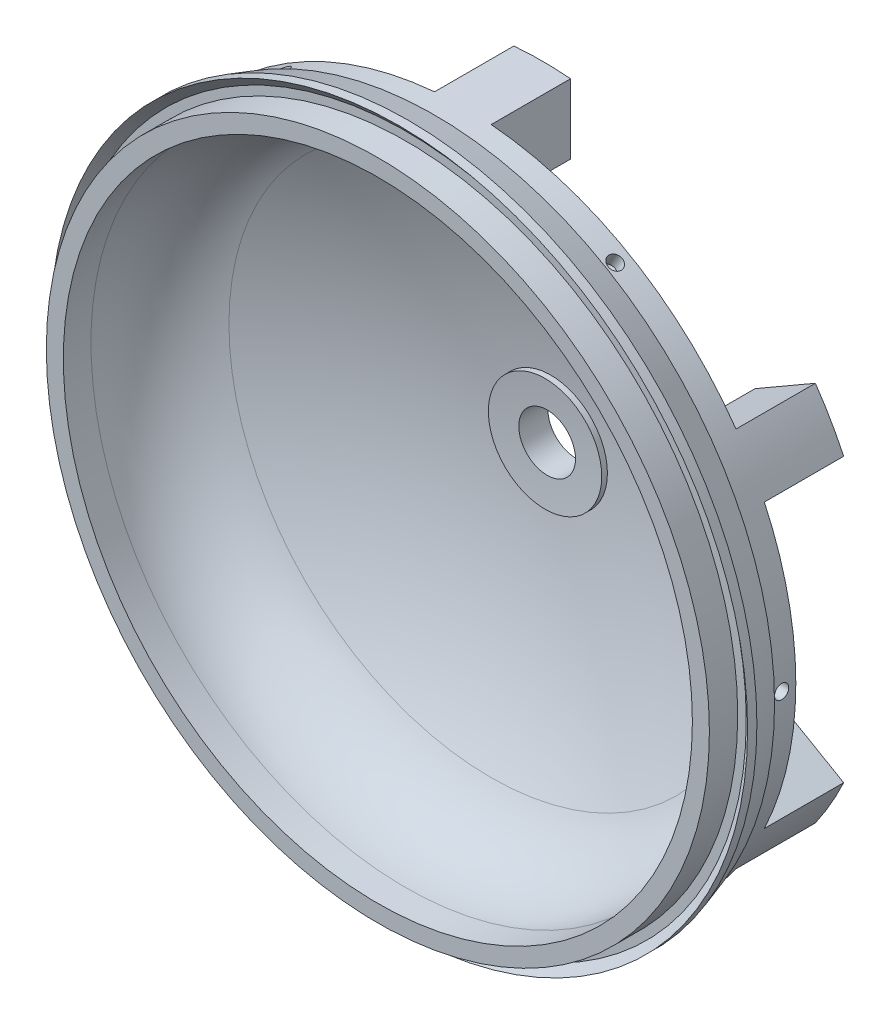
from build123d import *
from build123d.topology import SkipClean

# Parameters (mm, degrees)
CIRPATTERN1_COUNT   = 6
SKETCH17_R          = 12.7
CUT_EXTRUDE1_DEPTH  = 20.828
BOSS_EXTRUDE2_REACH = 234.871
CIRPATTERN2_COUNT   = 6


# Read off the part's stored shape, not the designer's step: Boss-Extrude1
with BuildPart() as part:
    # Sketch1 → Revolve1 (revolve)
    with BuildSketch(Plane(origin=(0, 0, 0), x_dir=(1, 0, 0), z_dir=(0, 1, 0)), mode=Mode.PRIVATE) as revolve1_sk:
        with BuildLine():
            Line((-148.59, 0), (-140.97, 0))
            Line((-140.97, 0), (-140.97, 12.391039743))
            ThreePointArc((-140.97, 12.391039743), (-134.615921102, 34.866271953), (-117.434796957, 50.687755913))
            ThreePointArc((-117.434796957, 50.687755913), (-60.367509579, 71.617582047), (0, 78.72368491))
            Line((0, 78.72368491), (0, 85.07368491))
            ThreePointArc((0, 85.07368491), (-61.842045719, 77.794008454), (-120.303258046, 56.352950612))
            ThreePointArc((-120.303258046, 56.352950612), (-131.462846302, 48.602983737), (-140.081763243, 38.1))
            Line((-140.081763243, 38.1), (-149.225, 38.1))
            Line((-149.225, 38.1), (-149.225, 25.4))
            Line((-149.225, 25.4), (-152.4, 25.4))
            Line((-152.4, 25.4), (-156.21, 13.674025723))
            Line((-156.21, 13.674025723), (-156.21, 9.503030405))
            Line((-156.21, 9.503030405), (-152.4, 12.7))
            Line((-152.4, 12.7), (-148.59, 12.7))
            Line((-148.59, 12.7), (-148.59, 0))
        make_face()
    revolve(revolve1_sk.sketch.rotate(Axis((0, 0, -78.72368491), (0, 0, -1)), 180), axis=Axis((0, 0, -78.72368491), (0, 0, -1)))

    # Sketch15 → 1/4 (0.25) Diameter Hole1 (revolve, cut)
    with BuildSketch(Plane(origin=(149.225, 0, -31.75), x_dir=(0, 0, -1), z_dir=(0, 1, 0))):
        Polygon((0, 0), (0, 8.257732465), (3.175, 6.35), (3.175, 0), align=None)
    f_1_4_0_25_diameter_hole1 = revolve(axis=Axis((155.575, 0, -31.75), (-1, 0, 0)), mode=Mode.SUBTRACT)

    # CirPattern1: 1/4 (0.25) Diameter Hole1 ×6 about axis
    cirpattern1_axis = Axis((0, 0, 5.473137056), (0, 0, -1))
    for i in range(1, CIRPATTERN1_COUNT):
        add(f_1_4_0_25_diameter_hole1.rotate(cirpattern1_axis, i * 360 / CIRPATTERN1_COUNT), mode=Mode.SUBTRACT)

    # Boss-Extrude1 outline → Boss-Extrude1 (revolve)
    with BuildSketch(Plane.XZ):
        with BuildLine():
            ThreePointArc((25.400000256, -74.927536766), (12.715521236, -75.869456094), (0, -76.18368491))
            Line((0, -76.18368491), (0, -88.9))
            Line((0, -88.9), (25.4, -88.9))
            Line((25.4, -88.9), (25.400000256, -74.927536766))
        make_face()
    revolve(axis=Axis((0, 0, 0), (0, 0, 1)))

    # Sketch17 → Cut-Extrude1 (cut)
    with BuildSketch(Plane.XY.offset(-88.9)):
        Circle(SKETCH17_R)
    extrude(amount=CUT_EXTRUDE1_DEPTH, mode=Mode.SUBTRACT)

    # Sketch18 → Boss-Extrude2 (add, up to next)
    with BuildSketch(Plane.XY.offset(-73.66), mode=Mode.PRIVATE) as boss_extrude2_sk1:
        with BuildLine():
            Line((-108.08633431, -47.738977372), (-95.38633431, -69.736022628))
            Line((-95.38633431, -69.736022628), (-122.413768075, -85.340318788))
            ThreePointArc((-122.413768075, -85.340318788), (-129.23264088, -74.6125), (-135.113768075, -63.343273532))
            Line((-135.113768075, -63.343273532), (-108.08633431, -47.738977372))
        make_face()
    boss_extrude2_tool1 = extrude(boss_extrude2_sk1.sketch, amount=BOSS_EXTRUDE2_REACH, mode=Mode.PRIVATE) - part.part
    boss_extrude2 = boss_extrude2_tool1.solids().sort_by_distance((-115.406756, -66.630122, -73.66))[0]
    add(boss_extrude2)

    # Sketch20 → 1/2 (0.5) Diameter Hole1 (revolve, cut)
    with SkipClean():  # the faces are left unmerged after this step: merging them gives an invalid solid
        with BuildSketch(Plane(origin=(-112.734856938, -65.0875, -73.66), x_dir=(0, 1, 0), z_dir=(1, 0, 0))):
            Polygon((0, 0), (0, 22.865464931), (6.35, 19.05), (6.35, 0), align=None)
        f_1_2_0_5_diameter_hole1 = revolve(axis=Axis((-112.734856938, -65.0875, -80.01), (0, 0, 1)), mode=Mode.SUBTRACT)

    # CirPattern2: Boss-Extrude2, 1/2 (0.5) Diameter Hole1 ×6 about axis
    cirpattern2_axis = Axis((0, 0, 0), (0, 0, 1))
    add([boss_extrude2.rotate(cirpattern2_axis, i * 360 / CIRPATTERN2_COUNT) for i in range(1, CIRPATTERN2_COUNT)])
    add([f_1_2_0_5_diameter_hole1.rotate(cirpattern2_axis, i * 360 / CIRPATTERN2_COUNT) for i in range(1, CIRPATTERN2_COUNT)], mode=Mode.SUBTRACT)


solid = part.part
